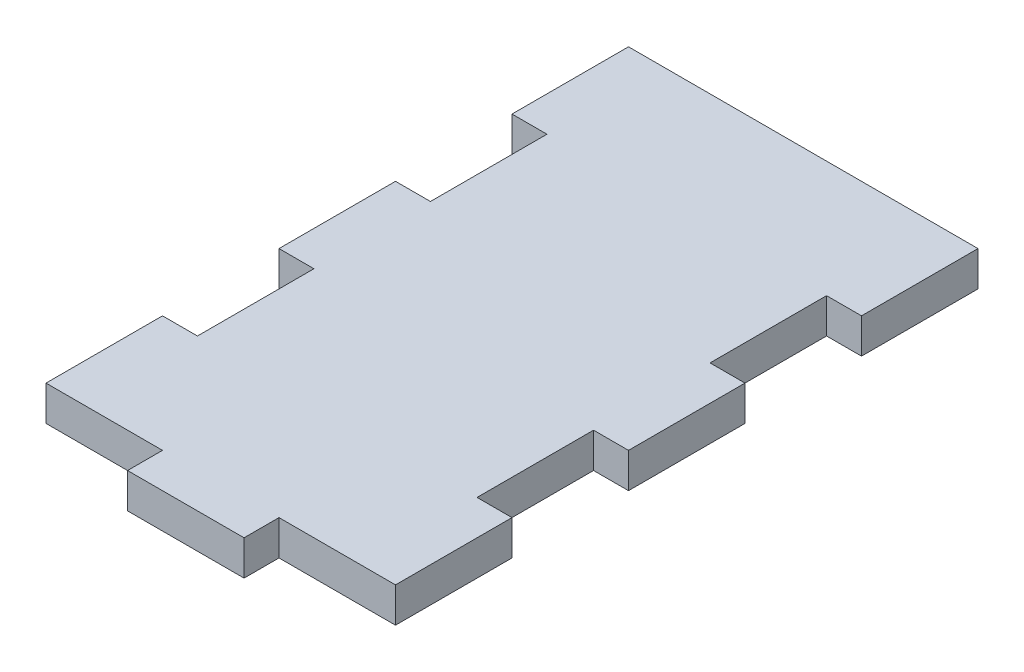
from build123d import *

# Parameters (mm, degrees)
SALIENTE_EXTRUIR1_DEPTH = 3


with BuildPart() as part:
    # Croquis1 → Saliente-Extruir1 (new body)
    with BuildSketch(Plane(origin=(0, 0, 0), x_dir=(1, 0, 0), z_dir=(0, 1, 0))):
        Polygon((0, 10), (0, 0), (10, 0), (10, -3), (20, -3), (20, 0), (30, 0), (30, 10), (27, 10), (27, 20), (30, 20), (30, 30), (27, 30), (27, 40), (30, 40), (30, 50), (0, 50), (0, 40), (3, 40), (3, 30), (0, 30), (0, 25), (0, 20), (3, 20), (3, 10), align=None)
    extrude(amount=SALIENTE_EXTRUIR1_DEPTH)


solid = part.part
